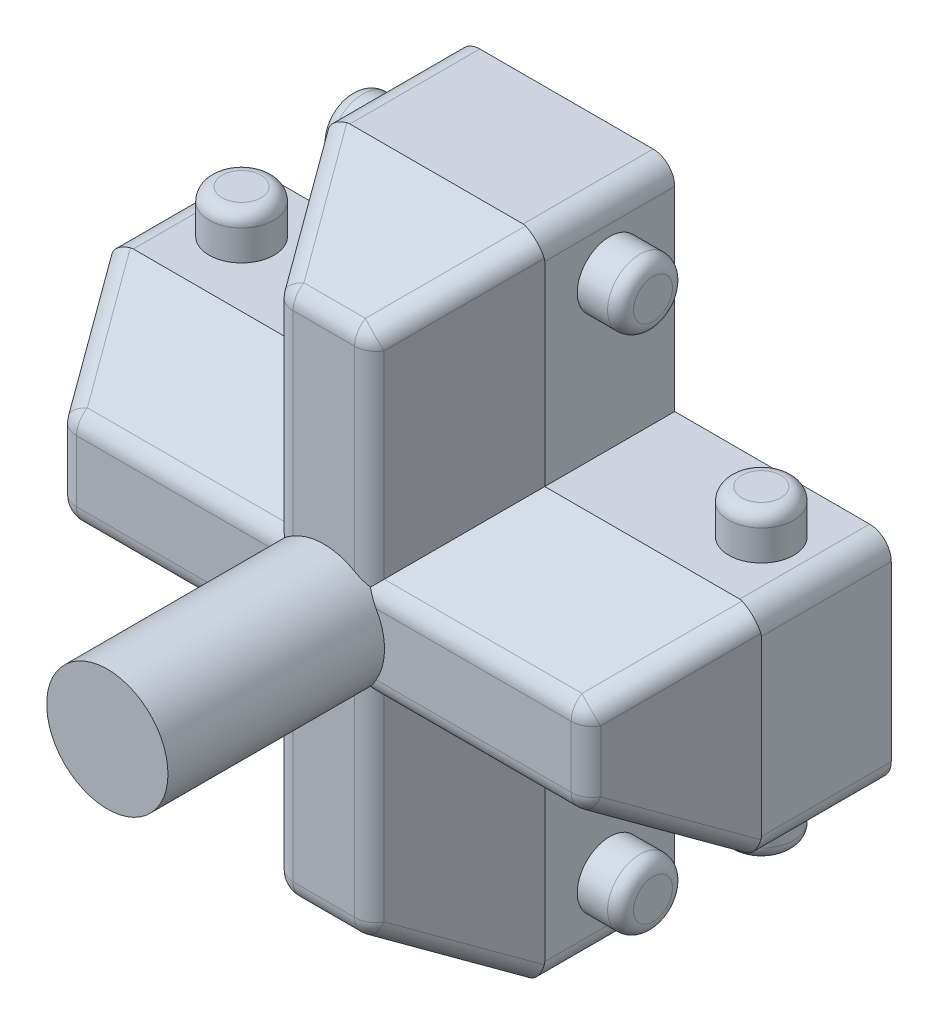
from build123d import *

# Parameters (mm, degrees)
SKETCH2_R           = 14
BOSS_EXTRUDE1_DEPTH = 76
BOSS_EXTRUDE2_START = 30
SKETCH3_W           = 50
SKETCH3_H           = 50
SKETCH3_R           = 14
BOSS_EXTRUDE2_DEPTH = 30
SKETCH5_R           = 7.5
BOSS_EXTRUDE3_DEPTH = 35
SKETCH6_R           = 7.5
BOSS_EXTRUDE4_DEPTH = 35
BOSS_EXTRUDE5_DEPTH = 26
BOSS_EXTRUDE5_DRAFT = 30
FILLET2_R           = 5
FILLET3_R           = 3


with BuildPart() as part:
    # Sketch2 → Boss-Extrude1 (new body)
    with BuildSketch(Plane.XY):
        Circle(SKETCH2_R)
    extrude(amount=BOSS_EXTRUDE1_DEPTH)

    # Sketch3 → Boss-Extrude2 (add)
    # profile 1 of 6: a face of its own
    with BuildSketch(Plane(origin=(0, 0, 0), x_dir=(-1, 0, 0), z_dir=(0, 0, -1)).offset(BOSS_EXTRUDE2_START)):
        with Locations((-50, 0)):
            Rectangle(SKETCH3_W, SKETCH3_H)
    # profile 2 of 6: a face of its own
    with BuildSketch(Plane(origin=(0, 0, 0), x_dir=(-1, 0, 0), z_dir=(0, 0, -1)).offset(BOSS_EXTRUDE2_START)):
        with Locations((0, 50)):
            Rectangle(SKETCH3_W, SKETCH3_H)
    # profile 3 of 6: a face of its own
    with BuildSketch(Plane(origin=(0, 0, 0), x_dir=(-1, 0, 0), z_dir=(0, 0, -1)).offset(BOSS_EXTRUDE2_START)):
        with Locations((50, 0)):
            Rectangle(SKETCH3_W, SKETCH3_H)
    # profile 4 of 6: a face of its own
    with BuildSketch(Plane(origin=(0, 0, 0), x_dir=(-1, 0, 0), z_dir=(0, 0, -1)).offset(BOSS_EXTRUDE2_START)):
        with Locations((0, -50)):
            Rectangle(SKETCH3_W, SKETCH3_H)
    # profile 5 of 6: a face of its own
    with BuildSketch(Plane(origin=(0, 0, 0), x_dir=(-1, 0, 0), z_dir=(0, 0, -1)).offset(BOSS_EXTRUDE2_START)):
        Rectangle(SKETCH3_W, SKETCH3_H)
        with Locations(Location((0, 0, 0), (0, 0, 180))):
            Circle(SKETCH3_R, mode=Mode.SUBTRACT)
    # profile 6 of 6: a face of its own
    with BuildSketch(Plane(origin=(0, 0, 0), x_dir=(-1, 0, 0), z_dir=(0, 0, -1)).offset(BOSS_EXTRUDE2_START)):
        with Locations(Location((0, 0, 0), (0, 0, 180))):
            Circle(SKETCH3_R)
    extrude(amount=-BOSS_EXTRUDE2_DEPTH)

    # Sketch5 → Boss-Extrude3 (add, symmetric)
    with BuildSketch(Plane(origin=(0, 0, 0), x_dir=(0, 0, -1), z_dir=(1, 0, 0))):
        with Locations((15, 60)):
            Circle(SKETCH5_R)
        with Locations(Location((15, -60, 0), (0, 0, 180))):
            Circle(SKETCH5_R)
    extrude(amount=BOSS_EXTRUDE3_DEPTH, both=True)

    # Sketch6 → Boss-Extrude4 (add, symmetric)
    with BuildSketch(Plane(origin=(0, 0, 0), x_dir=(1, 0, 0), z_dir=(0, 1, 0))):
        with Locations((-60, 15)):
            Circle(SKETCH6_R)
        with Locations(Location((60, 15, 0), (0, 0, 90))):
            Circle(SKETCH6_R)
    extrude(amount=BOSS_EXTRUDE4_DEPTH, both=True)


with BuildPart() as boss_extrude5_tool:
    # Sketch7 → Boss-Extrude5 (with draft: the straight prism first)
    with BuildSketch(Plane.XY):
        Polygon((25, -25), (75, -25), (75, 25), (25, 25), (25, 75), (-25, 75), (-25, 25), (-75, 25), (-75, -25), (-25, -25), (-25, -75), (25, -75), align=None)
    extrude(amount=BOSS_EXTRUDE5_DEPTH)
    # Boss-Extrude5: the draft: its side faces are tilted about the plane it starts from
    boss_extrude5_sides = [boss_extrude5_tool.faces().sort_by_distance(p)[0] for p in [
        (50, -25, 13),
        (75, 0, 13),
        (50, 25, 13),
        (25, 50, 13),
        (0, 75, 13),
        (-25, 50, 13),
        (-50, 25, 13),
        (-75, 0, 13),
        (-50, -25, 13),
        (-25, -50, 13),
        (0, -75, 13),
        (25, -50, 13),
    ]]
    draft(boss_extrude5_sides, Plane.XY, BOSS_EXTRUDE5_DRAFT)


with BuildPart() as part_1:
    add(part.part)

    # Boss-Extrude5: add boss_extrude5_tool
    add(boss_extrude5_tool.part)

    # Fillet2
    # the kernel refuses this fillet: 5 mm, written as the material it takes off along each edge
    with BuildSketch(Plane(origin=(7.102141655, -57.102141655, 21), x_dir=(0.8320502943378438, -0.277350098112615, -0.4803844614152609), z_dir=(0.3692744729379978, -0.3692744729379978, 0.8528028654224421))) as fillet2_piece_1_section:
        Polygon((-7.745966692, -7.745966692), (7.745966692, -7.745966692), (7.745966692, 7.745966692), (-7.745966692, 7.745966692), align=None)
    fillet2_piece_1 = extrude(amount=7.745966692, mode=Mode.PRIVATE)
    fillet2_piece_1 = split(fillet2_piece_1, bisect_by=Plane(origin=(7.102141655, -57.102141655, 21), z_dir=(1, 0, 0)), keep=Keep.TOP, mode=Mode.PRIVATE)
    fillet2_piece_1 = split(fillet2_piece_1, bisect_by=Plane(origin=(7.102141655, -57.102141655, 21), z_dir=(0, -1, 0)), keep=Keep.TOP, mode=Mode.PRIVATE)
    fillet2_piece_1 = split(fillet2_piece_1, bisect_by=Plane(origin=(7.102141655, -57.102141655, 21), z_dir=(-0.44721359549995865, 0.44721359549995865, 0.7745966692414825)), keep=Keep.TOP, mode=Mode.PRIVATE)
    fillet2_piece_1 = split(fillet2_piece_1, bisect_by=Plane(origin=(7.102141655, -61.432268674, 23.5), z_dir=(0, 0.866025403784438, -0.500000000000001)), keep=Keep.TOP, mode=Mode.PRIVATE)
    fillet2_piece_1 = split(fillet2_piece_1, bisect_by=Plane(origin=(7.102141655, -57.102141655, 26), z_dir=(0, 0, -1)), keep=Keep.TOP, mode=Mode.PRIVATE)
    fillet2_piece_1 = split(fillet2_piece_1, bisect_by=Plane(origin=(11.432268674, -57.102141655, 23.5), z_dir=(-0.866025403784438, 0, -0.500000000000001)), keep=Keep.TOP, mode=Mode.PRIVATE)
    fillet2_piece_1 = fillet2_piece_1 - Plane(origin=(7.102141655, -57.102141655, 21), x_dir=(-0.3692744729379978, 0.3692744729379978, -0.8528028654224421), z_dir=(0.8320502943378438, -0.277350098112615, -0.4803844614152609)) * Sphere(FILLET2_R, mode=Mode.PRIVATE)
    add(fillet2_piece_1, mode=Mode.SUBTRACT)
    with BuildSketch(Plane(origin=(57.102141655, -7.102141655, 21), x_dir=(-0.7071067811865476, -0.7071067811865475, 0), z_dir=(0.36927447293799776, -0.3692744729379978, 0.8528028654224421))) as fillet2_piece_2_section:
        Polygon((-7.745966692, -7.745966692), (7.745966692, -7.745966692), (7.745966692, 7.745966692), (-7.745966692, 7.745966692), align=None)
    fillet2_piece_2 = extrude(amount=7.745966692, mode=Mode.PRIVATE)
    fillet2_piece_2 = split(fillet2_piece_2, bisect_by=Plane(origin=(57.102141655, -7.102141655, 21), z_dir=(0, -1, 0)), keep=Keep.TOP, mode=Mode.PRIVATE)
    fillet2_piece_2 = split(fillet2_piece_2, bisect_by=Plane(origin=(57.102141655, -7.102141655, 21), z_dir=(-0.44721359549995865, 0.4472135954999587, 0.7745966692414825)), keep=Keep.TOP, mode=Mode.PRIVATE)
    fillet2_piece_2 = split(fillet2_piece_2, bisect_by=Plane(origin=(57.102141655, -7.102141655, 21), z_dir=(1, 0, 0)), keep=Keep.TOP, mode=Mode.PRIVATE)
    fillet2_piece_2 = split(fillet2_piece_2, bisect_by=Plane(origin=(57.102141655, -7.102141655, 26), z_dir=(0, 0, -1)), keep=Keep.TOP, mode=Mode.PRIVATE)
    fillet2_piece_2 = split(fillet2_piece_2, bisect_by=Plane(origin=(61.432268674, -7.102141655, 23.5), z_dir=(-0.866025403784438, 0, -0.500000000000001)), keep=Keep.TOP, mode=Mode.PRIVATE)
    fillet2_piece_2 = split(fillet2_piece_2, bisect_by=Plane(origin=(57.102141655, -11.432268674, 23.5), z_dir=(0, 0.866025403784438, -0.500000000000001)), keep=Keep.TOP, mode=Mode.PRIVATE)
    fillet2_piece_2 = fillet2_piece_2 - Plane(origin=(57.102141655, -7.102141655, 21), x_dir=(-0.36927447293799776, 0.3692744729379978, -0.8528028654224421), z_dir=(-0.7071067811865476, -0.7071067811865475, 0)) * Sphere(FILLET2_R, mode=Mode.PRIVATE)
    add(fillet2_piece_2, mode=Mode.SUBTRACT)
    with BuildSketch(Plane(origin=(57.102141655, 7.102141655, 21), x_dir=(-0.8320502943378438, -0.2773500981126148, 0.4803844614152609), z_dir=(0.36927447293799787, 0.3692744729379978, 0.8528028654224421))) as fillet2_piece_3_section:
        Polygon((-7.745966692, -7.745966692), (7.745966692, -7.745966692), (7.745966692, 7.745966692), (-7.745966692, 7.745966692), align=None)
    fillet2_piece_3 = extrude(amount=7.745966692, mode=Mode.PRIVATE)
    fillet2_piece_3 = split(fillet2_piece_3, bisect_by=Plane(origin=(57.102141655, 7.102141655, 21), z_dir=(-0.4472135954999587, -0.4472135954999586, 0.7745966692414826)), keep=Keep.TOP, mode=Mode.PRIVATE)
    fillet2_piece_3 = split(fillet2_piece_3, bisect_by=Plane(origin=(57.102141655, 7.102141655, 21), z_dir=(0, 1, 0)), keep=Keep.TOP, mode=Mode.PRIVATE)
    fillet2_piece_3 = split(fillet2_piece_3, bisect_by=Plane(origin=(57.102141655, 7.102141655, 21), z_dir=(1, 0, 0)), keep=Keep.TOP, mode=Mode.PRIVATE)
    fillet2_piece_3 = split(fillet2_piece_3, bisect_by=Plane(origin=(57.102141655, 11.432268674, 23.5), z_dir=(0, -0.866025403784438, -0.500000000000001)), keep=Keep.TOP, mode=Mode.PRIVATE)
    fillet2_piece_3 = split(fillet2_piece_3, bisect_by=Plane(origin=(61.432268674, 7.102141655, 23.5), z_dir=(-0.866025403784438, 0, -0.500000000000001)), keep=Keep.TOP, mode=Mode.PRIVATE)
    fillet2_piece_3 = split(fillet2_piece_3, bisect_by=Plane(origin=(57.102141655, 7.102141655, 26), z_dir=(0, 0, -1)), keep=Keep.TOP, mode=Mode.PRIVATE)
    fillet2_piece_3 = fillet2_piece_3 - Plane(origin=(57.102141655, 7.102141655, 21), x_dir=(-0.36927447293799787, -0.3692744729379978, -0.8528028654224421), z_dir=(-0.8320502943378438, -0.2773500981126148, 0.4803844614152609)) * Sphere(FILLET2_R, mode=Mode.PRIVATE)
    add(fillet2_piece_3, mode=Mode.SUBTRACT)
    with BuildSketch(Plane(origin=(7.102141655, 57.102141655, 21), x_dir=(0.7071067811865476, -0.7071067811865476, 0), z_dir=(0.3692744729379978, 0.3692744729379978, 0.8528028654224421))) as fillet2_piece_4_section:
        Polygon((-7.745966692, -7.745966692), (7.745966692, -7.745966692), (7.745966692, 7.745966692), (-7.745966692, 7.745966692), align=None)
    fillet2_piece_4 = extrude(amount=7.745966692, mode=Mode.PRIVATE)
    fillet2_piece_4 = split(fillet2_piece_4, bisect_by=Plane(origin=(7.102141655, 57.102141655, 21), z_dir=(1, 0, 0)), keep=Keep.TOP, mode=Mode.PRIVATE)
    fillet2_piece_4 = split(fillet2_piece_4, bisect_by=Plane(origin=(7.102141655, 57.102141655, 21), z_dir=(-0.44721359549995865, -0.44721359549995865, 0.7745966692414825)), keep=Keep.TOP, mode=Mode.PRIVATE)
    fillet2_piece_4 = split(fillet2_piece_4, bisect_by=Plane(origin=(7.102141655, 57.102141655, 21), z_dir=(0, 1, 0)), keep=Keep.TOP, mode=Mode.PRIVATE)
    fillet2_piece_4 = split(fillet2_piece_4, bisect_by=Plane(origin=(7.102141655, 57.102141655, 26), z_dir=(0, 0, -1)), keep=Keep.TOP, mode=Mode.PRIVATE)
    fillet2_piece_4 = split(fillet2_piece_4, bisect_by=Plane(origin=(7.102141655, 61.432268674, 23.5), z_dir=(0, -0.866025403784438, -0.500000000000001)), keep=Keep.TOP, mode=Mode.PRIVATE)
    fillet2_piece_4 = split(fillet2_piece_4, bisect_by=Plane(origin=(11.432268674, 57.102141655, 23.5), z_dir=(-0.866025403784438, 0, -0.500000000000001)), keep=Keep.TOP, mode=Mode.PRIVATE)
    fillet2_piece_4 = fillet2_piece_4 - Plane(origin=(7.102141655, 57.102141655, 21), x_dir=(-0.3692744729379978, -0.3692744729379978, -0.8528028654224421), z_dir=(0.7071067811865476, -0.7071067811865476, 0)) * Sphere(FILLET2_R, mode=Mode.PRIVATE)
    add(fillet2_piece_4, mode=Mode.SUBTRACT)
    with BuildSketch(Plane(origin=(-7.102141655, 57.102141655, 21), x_dir=(0.277350098112615, -0.8320502943378438, 0.4803844614152609), z_dir=(-0.3692744729379978, 0.3692744729379978, 0.8528028654224421))) as fillet2_piece_5_section:
        Polygon((-7.745966692, -7.745966692), (7.745966692, -7.745966692), (7.745966692, 7.745966692), (-7.745966692, 7.745966692), align=None)
    fillet2_piece_5 = extrude(amount=7.745966692, mode=Mode.PRIVATE)
    fillet2_piece_5 = split(fillet2_piece_5, bisect_by=Plane(origin=(-7.102141655, 57.102141655, 21), z_dir=(0, 1, 0)), keep=Keep.TOP, mode=Mode.PRIVATE)
    fillet2_piece_5 = split(fillet2_piece_5, bisect_by=Plane(origin=(-7.102141655, 57.102141655, 21), z_dir=(-1, 0, 0)), keep=Keep.TOP, mode=Mode.PRIVATE)
    fillet2_piece_5 = split(fillet2_piece_5, bisect_by=Plane(origin=(-7.102141655, 57.102141655, 21), z_dir=(0.44721359549995865, -0.44721359549995865, 0.7745966692414825)), keep=Keep.TOP, mode=Mode.PRIVATE)
    fillet2_piece_5 = split(fillet2_piece_5, bisect_by=Plane(origin=(-11.432268674, 57.102141655, 23.5), z_dir=(0.866025403784438, 0, -0.500000000000001)), keep=Keep.TOP, mode=Mode.PRIVATE)
    fillet2_piece_5 = split(fillet2_piece_5, bisect_by=Plane(origin=(-7.102141655, 57.102141655, 26), z_dir=(0, 0, -1)), keep=Keep.TOP, mode=Mode.PRIVATE)
    fillet2_piece_5 = split(fillet2_piece_5, bisect_by=Plane(origin=(-7.102141655, 61.432268674, 23.5), z_dir=(0, -0.866025403784438, -0.500000000000001)), keep=Keep.TOP, mode=Mode.PRIVATE)
    fillet2_piece_5 = fillet2_piece_5 - Plane(origin=(-7.102141655, 57.102141655, 21), x_dir=(0.3692744729379978, -0.3692744729379978, -0.8528028654224421), z_dir=(0.277350098112615, -0.8320502943378438, 0.4803844614152609)) * Sphere(FILLET2_R, mode=Mode.PRIVATE)
    add(fillet2_piece_5, mode=Mode.SUBTRACT)
    with BuildSketch(Plane(origin=(-57.102141655, 7.102141655, 21), x_dir=(0.7071067811865476, 0.7071067811865474, 0), z_dir=(-0.3692744729379977, 0.3692744729379978, 0.8528028654224421))) as fillet2_piece_6_section:
        Polygon((-7.745966692, -7.745966692), (7.745966692, -7.745966692), (7.745966692, 7.745966692), (-7.745966692, 7.745966692), align=None)
    fillet2_piece_6 = extrude(amount=7.745966692, mode=Mode.PRIVATE)
    fillet2_piece_6 = split(fillet2_piece_6, bisect_by=Plane(origin=(-57.102141655, 7.102141655, 21), z_dir=(-1, 0, 0)), keep=Keep.TOP, mode=Mode.PRIVATE)
    fillet2_piece_6 = split(fillet2_piece_6, bisect_by=Plane(origin=(-57.102141655, 7.102141655, 21), z_dir=(0.44721359549995865, -0.44721359549995876, 0.7745966692414825)), keep=Keep.TOP, mode=Mode.PRIVATE)
    fillet2_piece_6 = split(fillet2_piece_6, bisect_by=Plane(origin=(-57.102141655, 7.102141655, 21), z_dir=(0, 1, 0)), keep=Keep.TOP, mode=Mode.PRIVATE)
    fillet2_piece_6 = split(fillet2_piece_6, bisect_by=Plane(origin=(-57.102141655, 7.102141655, 26), z_dir=(0, 0, -1)), keep=Keep.TOP, mode=Mode.PRIVATE)
    fillet2_piece_6 = split(fillet2_piece_6, bisect_by=Plane(origin=(-57.102141655, 11.432268674, 23.5), z_dir=(0, -0.866025403784438, -0.500000000000001)), keep=Keep.TOP, mode=Mode.PRIVATE)
    fillet2_piece_6 = split(fillet2_piece_6, bisect_by=Plane(origin=(-61.432268674, 7.102141655, 23.5), z_dir=(0.866025403784438, 0, -0.500000000000001)), keep=Keep.TOP, mode=Mode.PRIVATE)
    fillet2_piece_6 = fillet2_piece_6 - Plane(origin=(-57.102141655, 7.102141655, 21), x_dir=(0.3692744729379977, -0.3692744729379978, -0.8528028654224421), z_dir=(0.7071067811865476, 0.7071067811865474, 0)) * Sphere(FILLET2_R, mode=Mode.PRIVATE)
    add(fillet2_piece_6, mode=Mode.SUBTRACT)
    with BuildSketch(Plane(origin=(-57.102141655, -7.102141655, 21), x_dir=(-0.7071067811865476, 0.7071067811865476, 0), z_dir=(-0.3692744729379978, -0.3692744729379978, 0.8528028654224421))) as fillet2_piece_7_section:
        Polygon((-7.745966692, -7.745966692), (7.745966692, -7.745966692), (7.745966692, 7.745966692), (-7.745966692, 7.745966692), align=None)
    fillet2_piece_7 = extrude(amount=7.745966692, mode=Mode.PRIVATE)
    fillet2_piece_7 = split(fillet2_piece_7, bisect_by=Plane(origin=(-57.102141655, -7.102141655, 21), z_dir=(-1, 0, 0)), keep=Keep.TOP, mode=Mode.PRIVATE)
    fillet2_piece_7 = split(fillet2_piece_7, bisect_by=Plane(origin=(-57.102141655, -7.102141655, 21), z_dir=(0.4472135954999587, 0.44721359549995865, 0.7745966692414826)), keep=Keep.TOP, mode=Mode.PRIVATE)
    fillet2_piece_7 = split(fillet2_piece_7, bisect_by=Plane(origin=(-57.102141655, -7.102141655, 21), z_dir=(0, -1, 0)), keep=Keep.TOP, mode=Mode.PRIVATE)
    fillet2_piece_7 = split(fillet2_piece_7, bisect_by=Plane(origin=(-57.102141655, -7.102141655, 26), z_dir=(0, 0, -1)), keep=Keep.TOP, mode=Mode.PRIVATE)
    fillet2_piece_7 = split(fillet2_piece_7, bisect_by=Plane(origin=(-57.102141655, -11.432268674, 23.5), z_dir=(0, 0.866025403784438, -0.500000000000001)), keep=Keep.TOP, mode=Mode.PRIVATE)
    fillet2_piece_7 = split(fillet2_piece_7, bisect_by=Plane(origin=(-61.432268674, -7.102141655, 23.5), z_dir=(0.866025403784438, 0, -0.500000000000001)), keep=Keep.TOP, mode=Mode.PRIVATE)
    fillet2_piece_7 = fillet2_piece_7 - Plane(origin=(-57.102141655, -7.102141655, 21), x_dir=(0.3692744729379978, 0.3692744729379978, -0.8528028654224421), z_dir=(-0.7071067811865476, 0.7071067811865476, 0)) * Sphere(FILLET2_R, mode=Mode.PRIVATE)
    add(fillet2_piece_7, mode=Mode.SUBTRACT)
    with BuildSketch(Plane(origin=(-7.102141655, -57.102141655, 21), x_dir=(0.8320502943378438, 0.277350098112615, 0.4803844614152609), z_dir=(-0.3692744729379978, -0.3692744729379978, 0.8528028654224421))) as fillet2_piece_8_section:
        Polygon((-7.745966692, -7.745966692), (7.745966692, -7.745966692), (7.745966692, 7.745966692), (-7.745966692, 7.745966692), align=None)
    fillet2_piece_8 = extrude(amount=7.745966692, mode=Mode.PRIVATE)
    fillet2_piece_8 = split(fillet2_piece_8, bisect_by=Plane(origin=(-7.102141655, -57.102141655, 21), z_dir=(0.44721359549995865, 0.44721359549995865, 0.7745966692414825)), keep=Keep.TOP, mode=Mode.PRIVATE)
    fillet2_piece_8 = split(fillet2_piece_8, bisect_by=Plane(origin=(-7.102141655, -57.102141655, 21), z_dir=(0, -1, 0)), keep=Keep.TOP, mode=Mode.PRIVATE)
    fillet2_piece_8 = split(fillet2_piece_8, bisect_by=Plane(origin=(-7.102141655, -57.102141655, 21), z_dir=(-1, 0, 0)), keep=Keep.TOP, mode=Mode.PRIVATE)
    fillet2_piece_8 = split(fillet2_piece_8, bisect_by=Plane(origin=(-7.102141655, -61.432268674, 23.5), z_dir=(0, 0.866025403784438, -0.500000000000001)), keep=Keep.TOP, mode=Mode.PRIVATE)
    fillet2_piece_8 = split(fillet2_piece_8, bisect_by=Plane(origin=(-11.432268674, -57.102141655, 23.5), z_dir=(0.866025403784438, 0, -0.500000000000001)), keep=Keep.TOP, mode=Mode.PRIVATE)
    fillet2_piece_8 = split(fillet2_piece_8, bisect_by=Plane(origin=(-7.102141655, -57.102141655, 26), z_dir=(0, 0, -1)), keep=Keep.TOP, mode=Mode.PRIVATE)
    fillet2_piece_8 = fillet2_piece_8 - Plane(origin=(-7.102141655, -57.102141655, 21), x_dir=(0.3692744729379978, 0.3692744729379978, -0.8528028654224421), z_dir=(0.8320502943378438, 0.277350098112615, 0.4803844614152609)) * Sphere(FILLET2_R, mode=Mode.PRIVATE)
    add(fillet2_piece_8, mode=Mode.SUBTRACT)
    with BuildSketch(Plane(origin=(25, 75, -42.5), x_dir=(-1, 0, 0), z_dir=(0, 0, 1)), Plane(origin=(75, 25, -42.5), x_dir=(-1, 0, 0), z_dir=(0, 0, 1)), Plane(origin=(75, -25, -42.5), x_dir=(0, 1, 0), z_dir=(0, 0, 1)), Plane(origin=(25, -75, -42.5), x_dir=(0, 1, 0), z_dir=(0, 0, 1)), Plane(origin=(-25, -75, -42.5), x_dir=(1, 0, 0), z_dir=(0, 0, 1)), Plane(origin=(-25, 75, -42.5), x_dir=(0, -1, 0), z_dir=(0, 0, 1))) as fillet2_piece_9:
        with BuildLine():
            CenterArc((FILLET2_R, FILLET2_R), FILLET2_R, 180, 90)
            Line((0, FILLET2_R), (0, 0))
            Line((0, 0), (FILLET2_R, 0))
        make_face()
    extrude(amount=55, mode=Mode.SUBTRACT)
    with BuildSketch(Plane(origin=(29.330127019, -79.330127019, -7.5), x_dir=(0.22360679774998068, 0.8944271909999155, -0.38729833462074154), z_dir=(-0.4472135954999587, 0.4472135954999587, 0.7745966692414826)), Plane(origin=(79.330127019, -29.330127019, -7.5), x_dir=(0.2236067977499784, 0.8944271909999154, -0.38729833462074287), z_dir=(-0.44721359549995865, 0.4472135954999587, 0.7745966692414825)), Plane(origin=(79.330127019, 29.330127019, -7.5), x_dir=(-0.8944271909999155, 0.2236067977499807, -0.3872983346207416), z_dir=(-0.4472135954999587, -0.4472135954999586, 0.7745966692414826)), Plane(origin=(29.330127019, 79.330127019, -7.5), x_dir=(-0.8944271909999156, 0.22360679774998238, -0.38729833462074054), z_dir=(-0.4472135954999587, -0.4472135954999587, 0.7745966692414826)), Plane(origin=(-29.330127019, 79.330127019, -7.5), x_dir=(-0.22360679774998068, -0.8944271909999155, -0.38729833462074154), z_dir=(0.4472135954999587, -0.4472135954999587, 0.7745966692414826)), Plane(origin=(-29.330127019, -79.330127019, -7.5), x_dir=(0.8944271909999155, -0.22360679774997924, -0.3872983346207424), z_dir=(0.4472135954999587, 0.4472135954999587, 0.7745966692414826))) as fillet2_piece_10:
        with BuildLine():
            CenterArc((FILLET2_R * 0.774596669241, FILLET2_R), FILLET2_R, 194.477512186, 75.522487814)
            Line((-FILLET2_R * 0.19364916731, FILLET2_R * 0.75), (0, 0))
            Line((0, 0), (FILLET2_R * 0.774596669241, 0))
        make_face()
    extrude(amount=41.957319584, mode=Mode.SUBTRACT)
    with BuildSketch(Plane(origin=(-79.330127019, 29.330127019, -7.5), x_dir=(0.8944271909999156, 0.2236067977499789, -0.3872983346207425), z_dir=(0.44721359549995865, -0.44721359549995876, 0.7745966692414825)), Plane(origin=(-79.330127019, -29.330127019, -7.5), x_dir=(-0.2236067977499792, 0.8944271909999155, -0.38729833462074237), z_dir=(0.4472135954999587, 0.44721359549995865, 0.7745966692414826))) as fillet2_piece_11:
        with BuildLine():
            CenterArc((FILLET2_R * 0.774596669241, -FILLET2_R), FILLET2_R, 90, 75.522487814)
            Line((-FILLET2_R * 0.19364916731, -FILLET2_R * 0.75), (0, 0))
            Line((0, 0), (FILLET2_R * 0.774596669241, 0))
        make_face()
    extrude(amount=41.957319584, mode=Mode.SUBTRACT)
    with BuildSketch(Plane(origin=(9.988893001, -57.102141655, 26), x_dir=(-1, 0, 0), z_dir=(0, 1, 0))) as fillet2_piece_12_section:
        with BuildLine():
            CenterArc((FILLET2_R * 0.57735026919, -FILLET2_R), FILLET2_R, 90, 60)
            Line((-FILLET2_R * 0.288675134595, -FILLET2_R * 0.5), (0, 0))
            Line((0, 0), (FILLET2_R * 0.57735026919, 0))
        make_face()
    fillet2_piece_12 = extrude(amount=54.330127019, mode=Mode.PRIVATE)
    fillet2_piece_12 = fillet2_piece_12 - Plane(origin=(0, 0, 26), x_dir=(1, 0, 0), z_dir=(0, 0, -1)) * Cylinder(14, 121, mode=Mode.PRIVATE)
    fillet2_piece_12 = split(fillet2_piece_12, bisect_by=Plane(origin=(9.988893001, -21.767205165, 5.599364905), z_dir=(0, -0.866025403784438, 0.500000000000001)), keep=Keep.TOP, mode=Mode.PRIVATE)
    add(fillet2_piece_12, mode=Mode.SUBTRACT)
    with BuildSketch(Plane(origin=(2.772014636, -9.988893001, 26), x_dir=(0, 1, 0), z_dir=(1, 0, 0))) as fillet2_piece_13_section:
        with BuildLine():
            CenterArc((FILLET2_R * 0.57735026919, -FILLET2_R), FILLET2_R, 90, 60)
            Line((-FILLET2_R * 0.288675134595, -FILLET2_R * 0.5), (0, 0))
            Line((0, 0), (FILLET2_R * 0.57735026919, 0))
        make_face()
    fillet2_piece_13 = extrude(amount=54.330127019, mode=Mode.PRIVATE)
    fillet2_piece_13 = fillet2_piece_13 - Plane(origin=(0, 0, 26), x_dir=(1, 0, 0), z_dir=(0, 0, -1)) * Cylinder(14, 121, mode=Mode.PRIVATE)
    fillet2_piece_13 = split(fillet2_piece_13, bisect_by=Plane(origin=(8.18467341, -9.988893001, 29.125), z_dir=(0.866025403784438, 0, 0.500000000000001)), keep=Keep.TOP, mode=Mode.PRIVATE)
    add(fillet2_piece_13, mode=Mode.SUBTRACT)
    with BuildSketch(Plane(origin=(59.988893001, -7.102141655, 26), x_dir=(-1, 0, 0), z_dir=(0, 1, 0)), Plane(origin=(7.102141655, 59.988893001, 26), x_dir=(0, -1, 0), z_dir=(-1, 0, 0)), Plane(origin=(-7.102141655, -59.988893001, 26), x_dir=(0, 1, 0), z_dir=(1, 0, 0))) as fillet2_piece_14:
        with BuildLine():
            CenterArc((FILLET2_R * 0.57735026919, -FILLET2_R), FILLET2_R, 90, 60)
            Line((-FILLET2_R * 0.288675134595, -FILLET2_R * 0.5), (0, 0))
            Line((0, 0), (FILLET2_R * 0.57735026919, 0))
        make_face()
    extrude(amount=14.20428331, mode=Mode.SUBTRACT)
    with BuildSketch(Plane(origin=(57.102141655, 9.988893001, 26), x_dir=(0, -1, 0), z_dir=(-1, 0, 0))) as fillet2_piece_15_section:
        with BuildLine():
            CenterArc((FILLET2_R * 0.57735026919, -FILLET2_R), FILLET2_R, 90, 60)
            Line((-FILLET2_R * 0.288675134595, -FILLET2_R * 0.5), (0, 0))
            Line((0, 0), (FILLET2_R * 0.57735026919, 0))
        make_face()
    fillet2_piece_15 = extrude(amount=54.330127019, mode=Mode.PRIVATE)
    fillet2_piece_15 = fillet2_piece_15 - Plane(origin=(0, 0, 26), x_dir=(1, 0, 0), z_dir=(0, 0, -1)) * Cylinder(14, 121, mode=Mode.PRIVATE)
    fillet2_piece_15 = split(fillet2_piece_15, bisect_by=Plane(origin=(21.767205165, 9.988893001, 5.599364905), z_dir=(0.866025403784438, 0, 0.500000000000001)), keep=Keep.TOP, mode=Mode.PRIVATE)
    add(fillet2_piece_15, mode=Mode.SUBTRACT)
    with BuildSketch(Plane(origin=(9.988893001, 2.772014636, 26), x_dir=(-1, 0, 0), z_dir=(0, 1, 0))) as fillet2_piece_16_section:
        with BuildLine():
            CenterArc((FILLET2_R * 0.57735026919, -FILLET2_R), FILLET2_R, 90, 60)
            Line((-FILLET2_R * 0.288675134595, -FILLET2_R * 0.5), (0, 0))
            Line((0, 0), (FILLET2_R * 0.57735026919, 0))
        make_face()
    fillet2_piece_16 = extrude(amount=54.330127019, mode=Mode.PRIVATE)
    fillet2_piece_16 = fillet2_piece_16 - Plane(origin=(0, 0, 26), x_dir=(1, 0, 0), z_dir=(0, 0, -1)) * Cylinder(14, 121, mode=Mode.PRIVATE)
    fillet2_piece_16 = split(fillet2_piece_16, bisect_by=Plane(origin=(9.988893001, 8.18467341, 29.125), z_dir=(0, 0.866025403784438, 0.500000000000001)), keep=Keep.TOP, mode=Mode.PRIVATE)
    add(fillet2_piece_16, mode=Mode.SUBTRACT)
    with BuildSketch(Plane(origin=(-9.988893001, 57.102141655, 26), x_dir=(-0.5000000000000018, 0, -0.8660254037844376), z_dir=(0, -1, 0))) as fillet2_piece_17_section:
        with BuildLine():
            CenterArc((FILLET2_R * 0.57735026919, FILLET2_R), FILLET2_R, 210, 60)
            Line((-FILLET2_R * 0.288675134595, FILLET2_R * 0.5), (0, 0))
            Line((0, 0), (FILLET2_R * 0.57735026919, 0))
        make_face()
    fillet2_piece_17 = extrude(amount=54.330127019, mode=Mode.PRIVATE)
    fillet2_piece_17 = split(fillet2_piece_17, bisect_by=Plane(origin=(-9.988893001, 21.767205165, 5.599364905), z_dir=(0, 0.866025403784438, 0.500000000000001)), keep=Keep.TOP, mode=Mode.PRIVATE)
    fillet2_piece_17 = fillet2_piece_17 - Plane(origin=(0, 0, 26), x_dir=(1, 0, 0), z_dir=(0, 0, -1)) * Cylinder(14, 121, mode=Mode.PRIVATE)
    add(fillet2_piece_17, mode=Mode.SUBTRACT)
    with BuildSketch(Plane(origin=(-2.772014636, 9.988893001, 26), x_dir=(0, 0.5000000000000017, -0.8660254037844376), z_dir=(-1, 0, 0))) as fillet2_piece_18_section:
        with BuildLine():
            CenterArc((FILLET2_R * 0.57735026919, FILLET2_R), FILLET2_R, 210, 60)
            Line((-FILLET2_R * 0.288675134595, FILLET2_R * 0.5), (0, 0))
            Line((0, 0), (FILLET2_R * 0.57735026919, 0))
        make_face()
    fillet2_piece_18 = extrude(amount=54.330127019, mode=Mode.PRIVATE)
    fillet2_piece_18 = split(fillet2_piece_18, bisect_by=Plane(origin=(-8.18467341, 9.988893001, 29.125), z_dir=(-0.866025403784438, 0, 0.500000000000001)), keep=Keep.TOP, mode=Mode.PRIVATE)
    fillet2_piece_18 = fillet2_piece_18 - Plane(origin=(0, 0, 26), x_dir=(1, 0, 0), z_dir=(0, 0, -1)) * Cylinder(14, 121, mode=Mode.PRIVATE)
    add(fillet2_piece_18, mode=Mode.SUBTRACT)
    with BuildSketch(Plane(origin=(-59.988893001, 7.102141655, 26), x_dir=(-0.5000000000000013, 0, -0.8660254037844378), z_dir=(0, -1, 0))) as fillet2_piece_19:
        with BuildLine():
            CenterArc((FILLET2_R * 0.57735026919, FILLET2_R), FILLET2_R, 210, 60)
            Line((-FILLET2_R * 0.288675134595, FILLET2_R * 0.5), (0, 0))
            Line((0, 0), (FILLET2_R * 0.57735026919, 0))
        make_face()
    extrude(amount=14.20428331, mode=Mode.SUBTRACT)
    with BuildSketch(Plane(origin=(-57.102141655, -9.988893001, 26), x_dir=(0, 1, 0), z_dir=(1, 0, 0))) as fillet2_piece_20_section:
        with BuildLine():
            CenterArc((FILLET2_R * 0.57735026919, -FILLET2_R), FILLET2_R, 90, 60)
            Line((-FILLET2_R * 0.288675134595, -FILLET2_R * 0.5), (0, 0))
            Line((0, 0), (FILLET2_R * 0.57735026919, 0))
        make_face()
    fillet2_piece_20 = extrude(amount=54.330127019, mode=Mode.PRIVATE)
    fillet2_piece_20 = fillet2_piece_20 - Plane(origin=(0, 0, 26), x_dir=(1, 0, 0), z_dir=(0, 0, -1)) * Cylinder(14, 121, mode=Mode.PRIVATE)
    fillet2_piece_20 = split(fillet2_piece_20, bisect_by=Plane(origin=(-21.767205165, -9.988893001, 5.599364905), z_dir=(-0.866025403784438, 0, 0.500000000000001)), keep=Keep.TOP, mode=Mode.PRIVATE)
    add(fillet2_piece_20, mode=Mode.SUBTRACT)
    with BuildSketch(Plane(origin=(-9.988893001, -2.772014636, 26), x_dir=(1, 0, 0), z_dir=(0, -1, 0))) as fillet2_piece_21_section:
        with BuildLine():
            CenterArc((FILLET2_R * 0.57735026919, -FILLET2_R), FILLET2_R, 90, 60)
            Line((-FILLET2_R * 0.288675134595, -FILLET2_R * 0.5), (0, 0))
            Line((0, 0), (FILLET2_R * 0.57735026919, 0))
        make_face()
    fillet2_piece_21 = extrude(amount=54.330127019, mode=Mode.PRIVATE)
    fillet2_piece_21 = fillet2_piece_21 - Plane(origin=(0, 0, 26), x_dir=(1, 0, 0), z_dir=(0, 0, -1)) * Cylinder(14, 121, mode=Mode.PRIVATE)
    fillet2_piece_21 = split(fillet2_piece_21, bisect_by=Plane(origin=(-9.988893001, -8.18467341, 29.125), z_dir=(0, -0.866025403784438, 0.500000000000001)), keep=Keep.TOP, mode=Mode.PRIVATE)
    add(fillet2_piece_21, mode=Mode.SUBTRACT)
    with BuildSketch(Plane(origin=(-75, -25, -42.5), x_dir=(0, 1, 0), z_dir=(0, 0, 1)), Plane(origin=(-75, 25, -42.5), x_dir=(1, 0, 0), z_dir=(0, 0, 1))) as fillet2_piece_22:
        with BuildLine():
            CenterArc((FILLET2_R, -FILLET2_R), FILLET2_R, 90, 90)
            Line((0, -FILLET2_R), (0, 0))
            Line((0, 0), (FILLET2_R, 0))
        make_face()
    extrude(amount=55, mode=Mode.SUBTRACT)
    with BuildSketch(Plane(origin=(2.772014636, -9.988893001, 26), x_dir=(0, 1, 0), z_dir=(1, 0, 0))) as fillet2_piece_23a_section:
        with BuildLine():
            CenterArc((FILLET2_R * 0.57735026919, -FILLET2_R), FILLET2_R, 90, 60)
            Line((-FILLET2_R * 0.288675134595, -FILLET2_R * 0.5), (0, 0))
            Line((0, 0), (FILLET2_R * 0.57735026919, 0))
        make_face()
    fillet2_piece_23a = extrude(amount=54.330127019, mode=Mode.PRIVATE)
    fillet2_piece_23a = fillet2_piece_23a - Plane(origin=(0, 0, 26), x_dir=(1, 0, 0), z_dir=(0, 0, -1)) * Cylinder(14, 121, mode=Mode.PRIVATE)
    fillet2_piece_23a = split(fillet2_piece_23a, bisect_by=Plane(origin=(8.18467341, -9.988893001, 29.125), z_dir=(-0.866025403784438, 0, -0.500000000000001)), keep=Keep.TOP, mode=Mode.PRIVATE)
    with BuildSketch(Plane(origin=(9.988893001, -57.102141655, 26), x_dir=(-1, 0, 0), z_dir=(0, 1, 0))) as fillet2_piece_23b_section:
        with BuildLine():
            CenterArc((FILLET2_R * 0.57735026919, -FILLET2_R), FILLET2_R, 90, 60)
            Line((-FILLET2_R * 0.288675134595, -FILLET2_R * 0.5), (0, 0))
            Line((0, 0), (FILLET2_R * 0.57735026919, 0))
        make_face()
    fillet2_piece_23b = extrude(amount=54.330127019, mode=Mode.PRIVATE)
    fillet2_piece_23b = fillet2_piece_23b - Plane(origin=(0, 0, 26), x_dir=(1, 0, 0), z_dir=(0, 0, -1)) * Cylinder(14, 121, mode=Mode.PRIVATE)
    fillet2_piece_23b = split(fillet2_piece_23b, bisect_by=Plane(origin=(9.988893001, -21.767205165, 5.599364905), z_dir=(0, 0.866025403784438, -0.500000000000001)), keep=Keep.TOP, mode=Mode.PRIVATE)
    fillet2_piece_23 = fillet2_piece_23a & fillet2_piece_23b
    add(fillet2_piece_23, mode=Mode.SUBTRACT)
    with BuildSketch(Plane(origin=(57.102141655, 9.988893001, 26), x_dir=(0, -1, 0), z_dir=(-1, 0, 0))) as fillet2_piece_24a_section:
        with BuildLine():
            CenterArc((FILLET2_R * 0.57735026919, -FILLET2_R), FILLET2_R, 90, 60)
            Line((-FILLET2_R * 0.288675134595, -FILLET2_R * 0.5), (0, 0))
            Line((0, 0), (FILLET2_R * 0.57735026919, 0))
        make_face()
    fillet2_piece_24a = extrude(amount=54.330127019, mode=Mode.PRIVATE)
    fillet2_piece_24a = fillet2_piece_24a - Plane(origin=(0, 0, 26), x_dir=(1, 0, 0), z_dir=(0, 0, -1)) * Cylinder(14, 121, mode=Mode.PRIVATE)
    fillet2_piece_24a = split(fillet2_piece_24a, bisect_by=Plane(origin=(21.767205165, 9.988893001, 5.599364905), z_dir=(-0.866025403784438, 0, -0.500000000000001)), keep=Keep.TOP, mode=Mode.PRIVATE)
    with BuildSketch(Plane(origin=(9.988893001, 2.772014636, 26), x_dir=(-1, 0, 0), z_dir=(0, 1, 0))) as fillet2_piece_24b_section:
        with BuildLine():
            CenterArc((FILLET2_R * 0.57735026919, -FILLET2_R), FILLET2_R, 90, 60)
            Line((-FILLET2_R * 0.288675134595, -FILLET2_R * 0.5), (0, 0))
            Line((0, 0), (FILLET2_R * 0.57735026919, 0))
        make_face()
    fillet2_piece_24b = extrude(amount=54.330127019, mode=Mode.PRIVATE)
    fillet2_piece_24b = fillet2_piece_24b - Plane(origin=(0, 0, 26), x_dir=(1, 0, 0), z_dir=(0, 0, -1)) * Cylinder(14, 121, mode=Mode.PRIVATE)
    fillet2_piece_24b = split(fillet2_piece_24b, bisect_by=Plane(origin=(9.988893001, 8.18467341, 29.125), z_dir=(0, -0.866025403784438, -0.500000000000001)), keep=Keep.TOP, mode=Mode.PRIVATE)
    fillet2_piece_24 = fillet2_piece_24a & fillet2_piece_24b
    add(fillet2_piece_24, mode=Mode.SUBTRACT)
    with BuildSketch(Plane(origin=(-2.772014636, 9.988893001, 26), x_dir=(0, 0.5000000000000017, -0.8660254037844376), z_dir=(-1, 0, 0))) as fillet2_piece_25a_section:
        with BuildLine():
            CenterArc((FILLET2_R * 0.57735026919, FILLET2_R), FILLET2_R, 210, 60)
            Line((-FILLET2_R * 0.288675134595, FILLET2_R * 0.5), (0, 0))
            Line((0, 0), (FILLET2_R * 0.57735026919, 0))
        make_face()
    fillet2_piece_25a = extrude(amount=54.330127019, mode=Mode.PRIVATE)
    fillet2_piece_25a = split(fillet2_piece_25a, bisect_by=Plane(origin=(-8.18467341, 9.988893001, 29.125), z_dir=(0.866025403784438, 0, -0.500000000000001)), keep=Keep.TOP, mode=Mode.PRIVATE)
    fillet2_piece_25a = fillet2_piece_25a - Plane(origin=(0, 0, 26), x_dir=(1, 0, 0), z_dir=(0, 0, -1)) * Cylinder(14, 121, mode=Mode.PRIVATE)
    with BuildSketch(Plane(origin=(-9.988893001, 57.102141655, 26), x_dir=(-0.5000000000000018, 0, -0.8660254037844376), z_dir=(0, -1, 0))) as fillet2_piece_25b_section:
        with BuildLine():
            CenterArc((FILLET2_R * 0.57735026919, FILLET2_R), FILLET2_R, 210, 60)
            Line((-FILLET2_R * 0.288675134595, FILLET2_R * 0.5), (0, 0))
            Line((0, 0), (FILLET2_R * 0.57735026919, 0))
        make_face()
    fillet2_piece_25b = extrude(amount=54.330127019, mode=Mode.PRIVATE)
    fillet2_piece_25b = split(fillet2_piece_25b, bisect_by=Plane(origin=(-9.988893001, 21.767205165, 5.599364905), z_dir=(0, -0.866025403784438, -0.500000000000001)), keep=Keep.TOP, mode=Mode.PRIVATE)
    fillet2_piece_25b = fillet2_piece_25b - Plane(origin=(0, 0, 26), x_dir=(1, 0, 0), z_dir=(0, 0, -1)) * Cylinder(14, 121, mode=Mode.PRIVATE)
    fillet2_piece_25 = fillet2_piece_25a & fillet2_piece_25b
    add(fillet2_piece_25, mode=Mode.SUBTRACT)
    with BuildSketch(Plane(origin=(-9.988893001, -2.772014636, 26), x_dir=(1, 0, 0), z_dir=(0, -1, 0))) as fillet2_piece_26a_section:
        with BuildLine():
            CenterArc((FILLET2_R * 0.57735026919, -FILLET2_R), FILLET2_R, 90, 60)
            Line((-FILLET2_R * 0.288675134595, -FILLET2_R * 0.5), (0, 0))
            Line((0, 0), (FILLET2_R * 0.57735026919, 0))
        make_face()
    fillet2_piece_26a = extrude(amount=54.330127019, mode=Mode.PRIVATE)
    fillet2_piece_26a = fillet2_piece_26a - Plane(origin=(0, 0, 26), x_dir=(1, 0, 0), z_dir=(0, 0, -1)) * Cylinder(14, 121, mode=Mode.PRIVATE)
    fillet2_piece_26a = split(fillet2_piece_26a, bisect_by=Plane(origin=(-9.988893001, -8.18467341, 29.125), z_dir=(0, 0.866025403784438, -0.500000000000001)), keep=Keep.TOP, mode=Mode.PRIVATE)
    with BuildSketch(Plane(origin=(-57.102141655, -9.988893001, 26), x_dir=(0, 1, 0), z_dir=(1, 0, 0))) as fillet2_piece_26b_section:
        with BuildLine():
            CenterArc((FILLET2_R * 0.57735026919, -FILLET2_R), FILLET2_R, 90, 60)
            Line((-FILLET2_R * 0.288675134595, -FILLET2_R * 0.5), (0, 0))
            Line((0, 0), (FILLET2_R * 0.57735026919, 0))
        make_face()
    fillet2_piece_26b = extrude(amount=54.330127019, mode=Mode.PRIVATE)
    fillet2_piece_26b = fillet2_piece_26b - Plane(origin=(0, 0, 26), x_dir=(1, 0, 0), z_dir=(0, 0, -1)) * Cylinder(14, 121, mode=Mode.PRIVATE)
    fillet2_piece_26b = split(fillet2_piece_26b, bisect_by=Plane(origin=(-21.767205165, -9.988893001, 5.599364905), z_dir=(0.866025403784438, 0, -0.500000000000001)), keep=Keep.TOP, mode=Mode.PRIVATE)
    fillet2_piece_26 = fillet2_piece_26a & fillet2_piece_26b
    add(fillet2_piece_26, mode=Mode.SUBTRACT)

    # Fillet3
    fillet3_edges = [part_1.edges().sort_by_distance(p)[0] for p in [
        (-35, 60, -7.5),
        (35, 60, -7.5),
        (-35, -60, -22.5),
        (35, -60, -22.5),
        (-67.5, -35, -15),
        (-67.5, 35, -15),
        (60, -35, -7.5),
        (60, 35, -7.5),
    ]]
    fillet(fillet3_edges, radius=FILLET3_R)


solid = part_1.part
